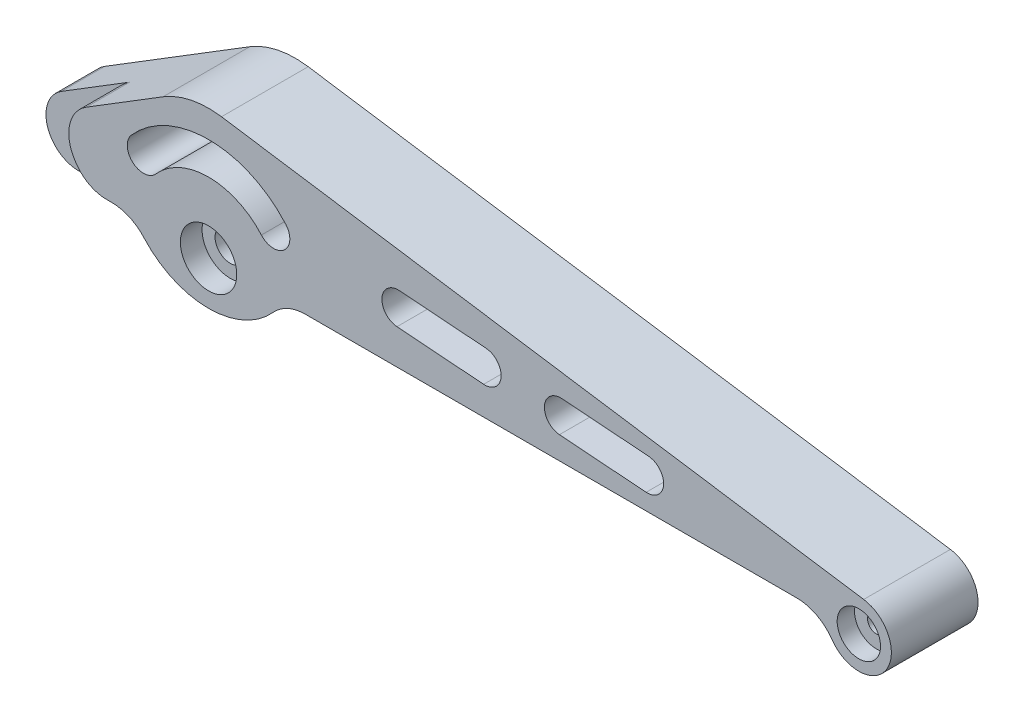
from build123d import *

# Parameters (mm, degrees)
SKETCH1_R           = 3.5
SKETCH1_R_2         = 2
BOSS_EXTRUDE1_DEPTH = 20
FILLET1_R           = 10
SKETCH2_R           = 2
CUT_EXTRUDE4_DEPTH  = 10
FILLET3_R           = 8.5
SKETCH3_R           = 6.5
CUT_EXTRUDE5_DEPTH  = 5
CUT_EXTRUDE7_START  = -5
SKETCH5_R           = 6.5
CUT_EXTRUDE7_DEPTH  = 5
SKETCH7_R           = 5
CUT_EXTRUDE8_DEPTH  = 4
CUT_EXTRUDE9_START  = -4
SKETCH8_R           = 5
CUT_EXTRUDE9_DEPTH  = 4


with BuildPart() as part:
    # Sketch1 → Boss-Extrude1 (new body)
    with BuildSketch(Plane.XY):
        with BuildLine():
            Line((-10.504774602, 27.019098406), (-43.939290476, 6.382161902))
            ThreePointArc((-43.939290476, 6.382161902), (-43.654129269, -6.54960604), (-32.5, 0))
            Line((-32.5, 0), (-17.320508076, 0))
            ThreePointArc((-17.320508076, 0), (0, -10), (17.320508076, 0))
            Line((17.320508076, 0), (142.5, 0))
            ThreePointArc((142.5, 0), (154.891549026, -5.685309853), (151.1193995, 7.4159925))
            Line((151.1193995, 7.4159925), (2.985065333, 29.77598))
            ThreePointArc((2.985065333, 29.77598), (-4.004573123, 29.594983902), (-10.504774602, 27.019098406))
        make_face()
        with BuildLine():
            ThreePointArc((12.1875, 10.748364701), (0, 16.25), (-12.1875, 10.748364701))
            ThreePointArc((-12.1875, 10.748364701), (-17.480391854, 10.416256555), (-17.8125, 15.709148409))
            ThreePointArc((-17.8125, 15.709148409), (0, 23.75), (17.8125, 15.709148409))
            ThreePointArc((17.8125, 15.709148409), (17.480391854, 10.416256555), (12.1875, 10.748364701))
        make_face(mode=Mode.SUBTRACT)
        with BuildLine():
            Line((44.021582733, 15.551547034), (64.021582733, 14.042107131))
            ThreePointArc((64.021582733, 14.042107131), (67.478730737, 10.020524397), (63.457148004, 6.563376394))
            Line((63.457148004, 6.563376394), (43.457148004, 8.072816297))
            ThreePointArc((43.457148004, 8.072816297), (40, 12.09439903), (44.021582733, 15.551547034))
        make_face(mode=Mode.SUBTRACT)
        with BuildLine():
            ThreePointArc((80.93587874, 5.244221712), (77.478730737, 9.265804446), (81.50031347, 12.722952449))
            Line((81.50031347, 12.722952449), (101.50031347, 11.213512546))
            ThreePointArc((101.50031347, 11.213512546), (104.957461474, 7.191929813), (100.93587874, 3.734781809))
            Line((100.93587874, 3.734781809), (80.93587874, 5.244221712))
        make_face(mode=Mode.SUBTRACT)
        Circle(SKETCH1_R, mode=Mode.SUBTRACT)
        with Locations((-40, 0)):
            Circle(SKETCH1_R_2, mode=Mode.SUBTRACT)
        with Locations((150, 0)):
            Circle(SKETCH1_R_2, mode=Mode.SUBTRACT)
    extrude(amount=BOSS_EXTRUDE1_DEPTH)

    # Fillet1
    fillet1_edges = [part.edges().sort_by_distance(p)[0] for p in [
        (-32.5, 0, 10),
        (142.5, 0, 10),
        (17.320508076, 0, 10),
        (-17.320508076, 0, 10),
    ]]
    fillet(fillet1_edges, radius=FILLET1_R)

    # Sketch2 → Cut-Extrude4 (cut)
    # profile 1 of 3: a face of its own
    with BuildSketch(Plane.XY.offset(20)):
        with BuildLine():
            ThreePointArc((-30, 0), (-30.37066789, 2.697399324), (-31.455192622, 5.194830784))
            ThreePointArc((-31.455192622, 5.194830784), (-34.377165478, 8.269445685), (-38.310752735, 9.856289549))
            Line((-38.310752735, 9.856289549), (-43.939290476, 6.382161902))
            ThreePointArc((-43.939290476, 6.382161902), (-45.44776232, -5.154792498), (-33.84511145, -4.285714286))
            ThreePointArc((-33.84511145, -4.285714286), (-32.155948906, -2.415537132), (-30.052880016, -1.027036525))
            ThreePointArc((-30.052880016, -1.027036525), (-30.013228754, -0.514198483), (-30, 0))
        make_face()
        with Locations((-40, 0)):
            Circle(SKETCH2_R, mode=Mode.SUBTRACT)
    # profile 2 of 3: a face of its own
    with BuildSketch(Plane.XY.offset(20)):
        with BuildLine():
            Line((-31.455192622, 5.194830784), (-35.386468794, 11.661258469))
            Line((-35.386468794, 11.661258469), (-38.310752735, 9.856289549))
            ThreePointArc((-38.310752735, 9.856289549), (-34.377165478, 8.269445685), (-31.455192622, 5.194830784))
        make_face()
    # profile 3 of 3: a face of its own
    with BuildSketch(Plane.XY.offset(20)):
        with BuildLine():
            Line((-28.108612186, -0.309849995), (-31.455192622, 5.194830784))
            ThreePointArc((-31.455192622, 5.194830784), (-30.37066789, 2.697399324), (-30, 0))
            ThreePointArc((-30, 0), (-30.013228754, -0.514198483), (-30.052880016, -1.027036525))
            ThreePointArc((-30.052880016, -1.027036525), (-29.099374287, -0.617942894), (-28.108612186, -0.309849995))
        make_face()
    extrude(amount=-CUT_EXTRUDE4_DEPTH, mode=Mode.SUBTRACT)

    # Fillet3
    # the kernel refuses this fillet: 8.5 mm, written as the material it takes off along each edge
    with BuildSketch(Plane(origin=(-35.386468794, 11.661258469, 41.107049778), x_dir=(0.85095492032363, 0.5252387300809077, 0), z_dir=(0, 0, -1))) as fillet3_piece_1:
        with BuildLine():
            CenterArc((FILLET3_R * 0.993272930738, FILLET3_R), FILLET3_R, 180.386732, 89.613268)
            Line((-FILLET3_R * 0.00670428980784, FILLET3_R * 0.993250304523), (0, 0))
            Line((0, 0), (FILLET3_R * 0.993272930738, 0))
        make_face()
    extrude(amount=31.107049778, mode=Mode.SUBTRACT)
    with BuildSketch(Plane(origin=(-28.108612186, -0.309849995, 32.856474207), x_dir=(0.9977308400995106, 0.06732882528549343, 0), z_dir=(0, 0, -1))) as fillet3_piece_2:
        with BuildLine():
            CenterArc((5.174335728, -8.480712141), FILLET3_R, 93.86057806, 58.702416165)
            Line((-2.369567013, -4.564140753), (-3.123957287, -4.172483615))
            Line((-3.123957287, -4.172483615), (-0.754390274, 0.391657139))
            Line((-0.754390274, 0.391657139), (0.154018939, 0.835929522))
            ThreePointArc((0.154018939, 0.835929522), (2.428046269, 0.705227783), (4.544811212, 0.848071214))
            Line((4.544811212, 0.848071214), (4.602040713, 0))
        make_face()
    extrude(amount=22.856474207, mode=Mode.SUBTRACT)

    # Sketch3 → Cut-Extrude5 (cut)
    with BuildSketch(Plane.XY.offset(20)):
        Circle(SKETCH3_R)
    extrude(amount=-CUT_EXTRUDE5_DEPTH, mode=Mode.SUBTRACT)

    # Sketch5 → Cut-Extrude7 (cut)
    with BuildSketch(Plane(origin=(0, 0, 0), x_dir=(-1, 0, 0), z_dir=(0, 0, -1)).offset(CUT_EXTRUDE7_START)):
        with Locations(Location((0, 0, 0), (0, 0, 180))):
            Circle(SKETCH5_R)
    extrude(amount=CUT_EXTRUDE7_DEPTH, mode=Mode.SUBTRACT)

    # Sketch7 → Cut-Extrude8 (cut)
    with BuildSketch(Plane(origin=(0, 0, 0), x_dir=(-1, 0, 0), z_dir=(0, 0, -1))):
        with Locations((-150, 0)):
            Circle(SKETCH7_R)
        with Locations((40, 0)):
            Circle(SKETCH7_R)
    extrude(amount=-CUT_EXTRUDE8_DEPTH, mode=Mode.SUBTRACT)

    # Sketch8 → Cut-Extrude9 (cut)
    with BuildSketch(Plane.XY.offset(20).offset(CUT_EXTRUDE9_START)):
        with Locations(Location((150, 0, 0), (0, 0, 180))):
            Circle(SKETCH8_R)
    extrude(amount=CUT_EXTRUDE9_DEPTH, mode=Mode.SUBTRACT)


solid = part.part
